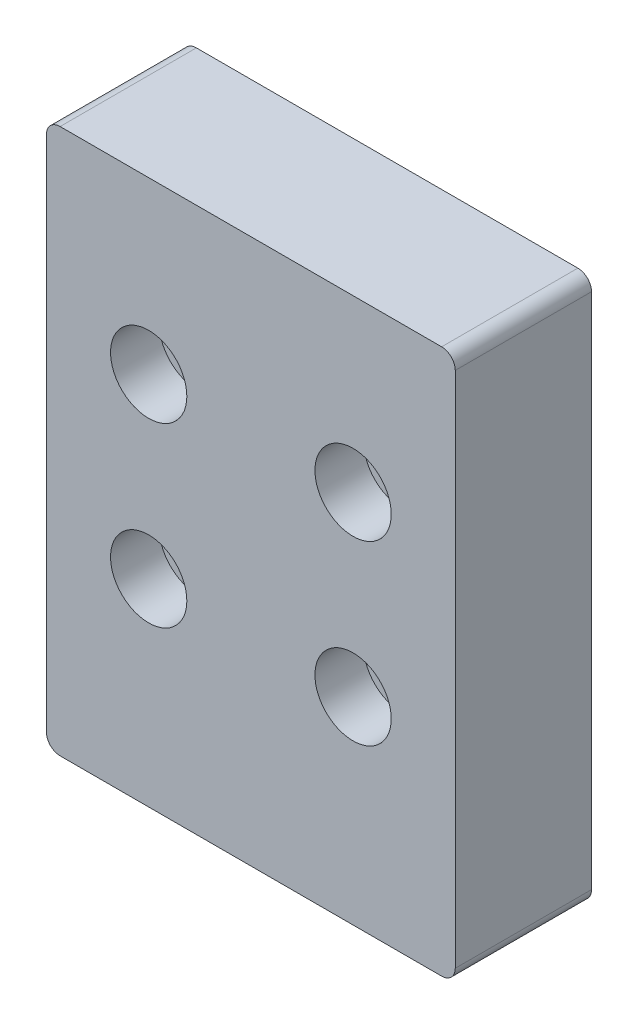
from build123d import *

# Parameters (mm, degrees)
SKETCH1_W                              = 30
SKETCH1_H                              = 40
BODY_DEPTH                             = 5
CBORE_FOR_M2_HEX_HEAD_BOLT2_AT_2_COUNT = 2
CBORE_FOR_M2_HEX_HEAD_BOLT2_AT_2_PITCH = 15
LPATTERN1_COUNT                        = 2
LPATTERN1_PITCH                        = 13
FILLET1_R                              = 1


with BuildPart() as part:
    # Sketch1 → Body (new, symmetric)
    with BuildSketch(Plane.XY):
        Rectangle(SKETCH1_W, SKETCH1_H)
    extrude(amount=BODY_DEPTH, both=True)

    # Sketch6 → CBORE for M2 Hex Head Bolt2 (revolve, cut)
    with BuildSketch(Plane(origin=(-7.5, 7.5, 5), x_dir=(0, -1, 0), z_dir=(1, 0, 0))):
        Polygon((0, 0), (0, 10.781118805), (1.3, 10), (1.3, 3.58), (2.8, 3.58), (2.8, 0), align=None)
    cbore_for_m2_hex_head_bolt2 = revolve(axis=Axis((-7.5, 7.5, 11.35), (0, 0, -1)), mode=Mode.SUBTRACT)

    # CBORE for M2 Hex Head Bolt2 at 2: CBORE for M2 Hex Head Bolt2 ×2
    with Locations(*[(i * CBORE_FOR_M2_HEX_HEAD_BOLT2_AT_2_PITCH, 0, 0) for i in range(1, CBORE_FOR_M2_HEX_HEAD_BOLT2_AT_2_COUNT)]):
        add(cbore_for_m2_hex_head_bolt2, mode=Mode.SUBTRACT)

    # LPattern1: CBORE for M2 Hex Head Bolt2 ×2
    with Locations(*[(0, -i * LPATTERN1_PITCH, 0) for i in range(1, LPATTERN1_COUNT)]):
        add(cbore_for_m2_hex_head_bolt2, mode=Mode.SUBTRACT)

    # LPattern1 copy 1 sketch → LPattern1 copy 1 (revolve, cut)
    with BuildSketch(Plane(origin=(7.5, -5.5, 5), x_dir=(0, -1, 0), z_dir=(1, 0, 0))):
        Polygon((0, 0), (0, 10.781118805), (1.3, 10), (1.3, 3.58), (2.8, 3.58), (2.8, 0), align=None)
    revolve(axis=Axis((7.5, -5.5, 11.35), (0, 0, -1)), mode=Mode.SUBTRACT)

    # Fillet1
    fillet1_edges = [part.edges().sort_by_distance(p)[0] for p in [
        (15, 20, 0),
        (15, -20, 0),
        (-15, -20, 0),
        (-15, 20, 0),
    ]]
    fillet(fillet1_edges, radius=FILLET1_R)


solid = part.part
